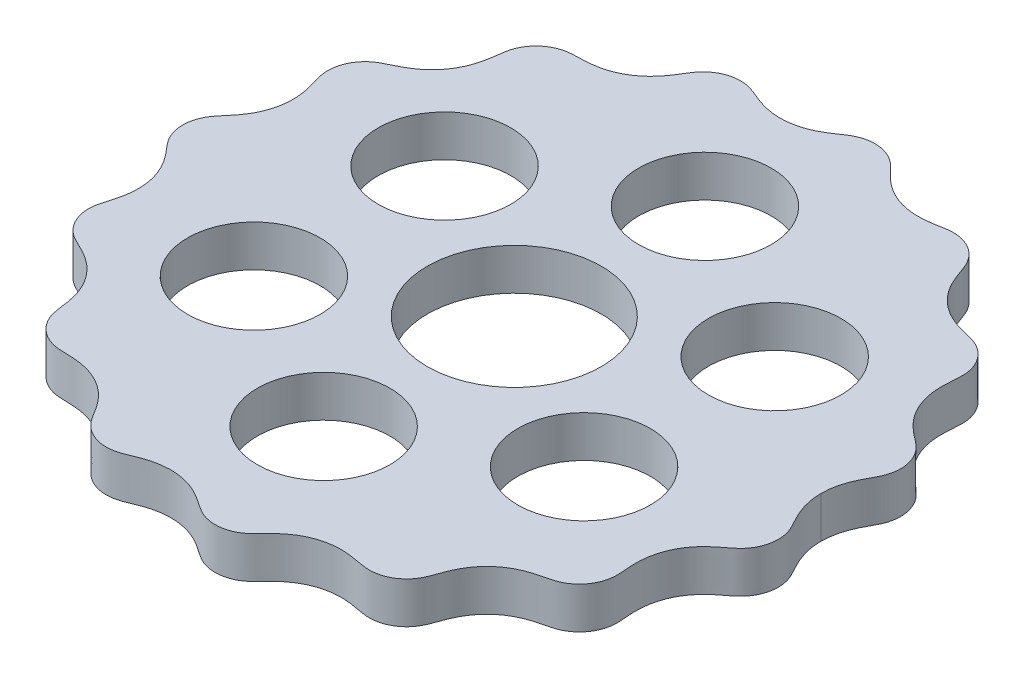
from build123d import *

# Parameters (mm, degrees)
SKETCH1_R           = 10.5
SKETCH1_R_2         = 8
BOSS_EXTRUDE1_DEPTH = 5


with BuildPart() as part:
    # Sketch1 → Boss-Extrude1 (new body)
    with BuildSketch(Plane(origin=(0, 0, 0), x_dir=(1, 0, 0), z_dir=(0, 1, 0))):
        with BuildLine():
            add(Edge.make_bspline(
                [(37, 0), (37, -0.03143727), (37.000453604, -0.094999987), (37.002494823, -0.209960319), (37.007935699, -0.365962041), (37.018130067, -0.547435978), (37.035778539, -0.762613663), (37.062295011, -1.000704503), (37.099596576, -1.254145629), (37.141666769, -1.490121949), (37.186730566, -1.707704996), (37.27599878, -2.086217996), (37.432607644, -2.61967024), (37.650272858, -3.191702622), (37.93344139, -3.795551093), (38.205952219, -4.315706499), (38.450459887, -4.760622269), (38.70692772, -5.235202277), (38.941768983, -5.756697541), (39.137855891, -6.378800099), (39.247955338, -7.103857197), (39.228570469, -7.939956238), (39.019285386, -8.855824089), (38.577559758, -9.823505319), (37.820964583, -10.754370621), (36.848063751, -11.434964366), (35.925475538, -12.170726431), (35.15516003, -12.931370117), (34.54379505, -13.69507461), (33.895237033, -14.741994379), (33.428420875, -15.89037885), (33.16127245, -17.104145416), (33.090755906, -18.276711654), (33.117928675, -19.134785899), (33.184630754, -19.922725011), (33.242632466, -20.644624385), (33.219628568, -21.437875666), (33.036316371, -22.28173929), (32.662226146, -23.128482681), (32.07870968, -23.926433825), (31.270520944, -24.647504284), (30.212930356, -25.19576041), (29.05618735, -25.42594367), (27.921165014, -25.714783041), (26.912865036, -26.088040866), (26.04670806, -26.526543792), (25.231490798, -27.070153578), (24.486296273, -27.716224909), (23.823206932, -28.456781999), (23.254813288, -29.28043732), (22.819009974, -30.105428972), (22.489240246, -30.904456359), (22.226168392, -31.656017359), (21.986325362, -32.344433223), (21.645702746, -33.067171886), (21.136896315, -33.772149992), (20.444596547, -34.405183962), (19.573466112, -34.908137767), (18.679093954, -35.191155104), (17.814153371, -35.279328837), (17.017950382, -35.212908103), (16.301803877, -35.076487107), (15.519474027, -34.928387551), (14.662477813, -34.814713427), (13.480415131, -34.769744423), (12.24114903, -34.919564924), (11.051981736, -35.275534421), (9.949378285, -35.820248955), (9.136432454, -36.351322247), (8.309098279, -37.037782147), (7.491403013, -37.876399022), (6.713712112, -38.763029071), (5.710099738, -39.404826424), (4.681547406, -39.744189192), (3.698738629, -39.8505626), (2.778395229, -39.751156366), (1.955929975, -39.487981912), (1.257453315, -39.111274685), (0.66127052, -38.700097997), (0.01224613, -38.248357139), (-0.717280827, -37.795796162), (-1.768012922, -37.270567489), (-2.95273679, -36.895066329), (-4.18067966, -36.725111536), (-5.411611299, -36.763370496), (-6.378691756, -36.910893684), (-7.422567545, -37.197831252), (-8.521082833, -37.628680278), (-9.596894828, -38.131330913), (-10.781414037, -38.320591212), (-11.865254321, -38.217684032), (-12.80999509, -37.9179101), (-13.765403055, -37.370059654), (-14.639711952, -36.510029041), (-15.224959633, -35.447056134), (-15.875186541, -34.432134448), (-16.722685045, -33.381987434), (-17.645169148, -32.549366783), (-18.695344863, -31.881164301), (-19.839308599, -31.403126169), (-20.793085274, -31.134677942), (-21.881721134, -30.964500418), (-23.08542905, -30.908652495), (-24.29883225, -30.933417714), (-25.48067958, -30.606197148), (-26.432898172, -30.052748184), (-27.164845045, -29.384446692), (-27.795906987, -28.497278621), (-28.22424747, -27.376816762), (-28.326856094, -26.193816744), (-28.502980453, -25.027046281), (-28.77642721, -23.979556748), (-29.132206305, -23.068277652), (-29.714540354, -21.983130932), (-30.475695851, -21.00467793), (-31.393252135, -20.166428113), (-32.373478982, -19.519081263), (-33.130172271, -19.113573458), (-33.84590289, -18.77737139), (-34.500084654, -18.46665169), (-35.175559663, -18.050104616), (-35.814710148, -17.469419425), (-36.360966849, -16.722076386), (-36.760254169, -15.817760445), (-36.980625548, -14.757313596), (-36.926633396, -13.567284637), (-36.547607451, -12.450425228), (-36.230236904, -11.323045641), (-36.049340213, -10.26320608), (-35.996011997, -9.293835891), (-36.059190915, -8.316040478), (-36.246094895, -7.347633333), (-36.555913141, -6.403126162), (-36.984986238, -5.499015409), (-37.4816085, -4.709168383), (-38.008605013, -4.023960491), (-38.528096971, -3.420524046), (-39.004092361, -2.868313104), (-39.352986229, -2.366627777), (-39.578197628, -1.930892753), (-39.717578718, -1.588781598), (-39.798314559, -1.352462416), (-39.865873622, -1.112280963), (-39.913167386, -0.89900512), (-39.945298995, -0.714032442), (-39.966442184, -0.560824818), (-39.979976403, -0.438104208), (-39.99012853, -0.31081675), (-39.99689741, -0.175935477), (-39.999435894, -0.08120679), (-40, -0.026915073), (-40, 0)],
                knots=[0.06614426, 0.06614426, 0.06614426, 0.06614426, 0.06614426, 0.067102742, 0.068061224, 0.069019706, 0.069978188, 0.071895152, 0.073812116, 0.075273751, 0.076735387, 0.078197023, 0.079658659, 0.085505202, 0.091351745, 0.094275016, 0.097198288, 0.100954467, 0.104710646, 0.108466825, 0.112223004, 0.118069589, 0.123916173, 0.130338535, 0.136760898, 0.145879075, 0.154997253, 0.161421442, 0.167845631, 0.17426982, 0.18069401, 0.193736695, 0.200258038, 0.206779381, 0.211541823, 0.216304265, 0.221066707, 0.225829148, 0.232348859, 0.238868571, 0.245245472, 0.251622373, 0.260676895, 0.269731417, 0.276109562, 0.282487707, 0.288865852, 0.295243997, 0.301811097, 0.308378198, 0.314945298, 0.321512399, 0.326307116, 0.331101834, 0.335896552, 0.340691269, 0.347256117, 0.353820965, 0.360385813, 0.366950661, 0.371745379, 0.376540096, 0.381334814, 0.386129532, 0.392696632, 0.399263733, 0.412397934, 0.418776079, 0.425154223, 0.431532368, 0.437910513, 0.446965035, 0.456019557, 0.462396459, 0.46877336, 0.475293071, 0.481812782, 0.486575224, 0.491337666, 0.496100107, 0.500862549, 0.507383892, 0.513905235, 0.526947921, 0.53337211, 0.539796299, 0.546220489, 0.552644678, 0.561762855, 0.570881032, 0.577303395, 0.583725757, 0.590229974, 0.596734191, 0.606102622, 0.615471053, 0.621977695, 0.628484337, 0.641497621, 0.648004263, 0.654510905, 0.661017547, 0.667524189, 0.67689262, 0.686261051, 0.692765268, 0.699269485, 0.705691847, 0.71211421, 0.721232387, 0.730350565, 0.736774754, 0.743198943, 0.749623132, 0.756047322, 0.769090007, 0.77561135, 0.782132693, 0.786895135, 0.791657577, 0.796420019, 0.80118246, 0.807702171, 0.814221883, 0.820598784, 0.826975685, 0.836030207, 0.845084729, 0.851462874, 0.857841019, 0.864219164, 0.870597309, 0.877164409, 0.88373151, 0.89029861, 0.896865711, 0.901660428, 0.906455146, 0.911249864, 0.916044581, 0.917685793, 0.919327005, 0.920968217, 0.922609429, 0.924250641, 0.925071247, 0.925891853, 0.926712459, 0.927533065, 0.928353671, 0.929174277, 0.929174277, 0.929174277, 0.929174277, 0.929174277], degree=4))
            add(Edge.make_bspline(
                [(-40, 0), (-40, 0.026915073), (-39.999435898, 0.081102132), (-39.996897439, 0.173969707), (-39.990128591, 0.308512197), (-39.979976315, 0.43784111), (-39.96644193, 0.561596862), (-39.949527385, 0.683811751), (-39.92923545, 0.806418669), (-39.905569953, 0.929082564), (-39.878536112, 1.05108509), (-39.840542165, 1.202393225), (-39.788245672, 1.382030281), (-39.717511124, 1.588706673), (-39.612678592, 1.8465975), (-39.4787487, 2.123083835), (-39.310663945, 2.414096923), (-39.104945299, 2.715281305), (-38.881313352, 3.003243592), (-38.647115103, 3.282501031), (-38.34984736, 3.627713203), (-37.95291863, 4.096180366), (-37.481683121, 4.709256859), (-36.984926096, 5.498908372), (-36.555971315, 6.403267497), (-36.170215472, 7.578337946), (-35.9868127, 8.798814705), (-36.009059108, 10.024440425), (-36.200622014, 11.152023378), (-36.408520549, 11.955019807), (-36.630718407, 12.680349542), (-36.821563566, 13.341696839), (-36.992348492, 14.33180594), (-36.904909082, 15.422182159), (-36.504382838, 16.524262833), (-35.814997617, 17.469697467), (-35.175412137, 18.050006312), (-34.5001255, 18.466591368), (-33.84600501, 18.777687977), (-32.905560624, 19.218134843), (-31.725163504, 19.887218348), (-30.439584969, 20.966645125), (-29.285197967, 22.586057403), (-28.686625036, 24.137217697), (-28.434119871, 25.439027518), (-28.31164158, 26.439459997), (-28.21864172, 27.126579635), (-28.036118522, 27.870890122), (-27.694662989, 28.638492196), (-27.164686183, 29.384972568), (-26.433444718, 30.052566346), (-25.634630631, 30.516068805), (-24.823088132, 30.788827784), (-24.04685872, 30.899230803), (-23.334712945, 30.920266621), (-22.306444557, 30.937751057), (-20.963494482, 31.058617768), (-19.344902311, 31.506985138), (-17.613398371, 32.506669405), (-16.415804752, 33.684227657), (-15.639656073, 34.786823183), (-15.110379913, 35.668587511), (-14.736089473, 36.274805934), (-14.252362947, 36.891838815), (-13.610375494, 37.458275746), (-12.809563546, 37.918317809), (-11.865789642, 38.217794604), (-10.954330273, 38.303527797), (-10.118839611, 38.215435923), (-9.382986221, 38.00135041), (-8.741423229, 37.738330824), (-7.813784142, 37.344183911), (-6.560131184, 36.91195486), (-4.917500499, 36.654754125), (-2.937854825, 36.844776382), (-1.360254549, 37.418406773), (-0.190612674, 38.106118753), (0.66104769, 38.700344294), (1.25752551, 39.11128049), (1.955942055, 39.487804143), (2.778297019, 39.751545742), (3.94176, 39.875855803), (5.096453052, 39.671677477), (6.084466159, 39.202219931), (6.856533473, 38.559253291), (7.333854157, 38.063319478), (7.850909823, 37.508190885), (8.442374814, 36.92670684), (9.323110596, 36.196912537), (10.58841665, 35.435636692), (11.999200644, 34.94870835), (13.48033229, 34.769799778), (14.662523081, 34.814686453), (15.519442707, 34.928402455), (16.301826743, 35.076481327), (17.01792965, 35.21290787), (17.814178726, 35.27933238), (18.679056308, 35.191146999), (19.573524947, 34.908152618), (20.444504658, 34.405159426), (21.137044029, 33.772190195), (21.591803381, 33.141505578), (21.869639533, 32.592625152), (22.075891139, 32.086193752), (22.226561366, 31.656080042), (22.376591176, 31.226097871), (22.593668003, 30.651444897), (22.86151291, 30.024879345), (23.255100485, 29.280174836), (23.822818619, 28.457094584), (24.649069231, 27.534594711), (25.802527601, 26.61516732), (27.218058872, 25.905303721), (28.817567995, 25.472660001), (30.452832349, 25.14875342), (31.698805724, 24.383263182), (32.56091801, 23.351770837), (33.037621539, 22.281751264), (33.218869869, 21.437861265), (33.242984107, 20.64464847), (33.184772246, 19.922675951), (33.096291135, 18.887971334), (33.085336205, 17.531197285), (33.377495648, 15.878125019), (34.202660288, 14.068701252), (35.246780487, 12.774733869), (36.247889348, 11.905159004), (37.053074749, 11.298868113), (37.601617193, 10.874775338), (38.154972669, 10.344538529), (38.64897071, 9.665047684), (39.030511654, 8.832802317), (39.242952499, 7.865782472), (39.245093638, 6.94215806), (39.075312522, 6.10308858), (38.783182879, 5.375443563), (38.444617083, 4.748588598), (38.126578469, 4.173031944), (37.854861766, 3.633998474), (37.633034591, 3.131674523), (37.47857496, 2.727184292), (37.362612428, 2.374730281), (37.2774171, 2.077549654), (37.216377239, 1.837879163), (37.162604445, 1.596443845), (37.116253691, 1.353582746), (37.077446812, 1.109379842), (37.050179424, 0.893728529), (37.031634183, 0.710857807), (37.019415923, 0.558351339), (37.011589025, 0.433066649), (37.00424606, 0.269586224), (37.00097986, 0.133534053), (37, 0.053352873), (37, 0)],
                knots=[0.070825729, 0.070825729, 0.070825729, 0.070825729, 0.070825729, 0.071646335, 0.072466941, 0.073287547, 0.074108153, 0.074928759, 0.075749365, 0.076569971, 0.077390577, 0.078211183, 0.079031789, 0.080673002, 0.082314214, 0.083955426, 0.086352785, 0.088750144, 0.091147503, 0.093544862, 0.095942221, 0.09833958, 0.103134298, 0.109701399, 0.1162685, 0.122835601, 0.129402703, 0.142158993, 0.148537139, 0.154915284, 0.159442546, 0.163969807, 0.168497068, 0.17302433, 0.185778133, 0.192297845, 0.198817557, 0.203579999, 0.208342441, 0.213104883, 0.217867326, 0.230910013, 0.243952699, 0.256801079, 0.269649459, 0.274208548, 0.278767637, 0.283326726, 0.287885815, 0.294308178, 0.300730541, 0.307234758, 0.313738976, 0.318423192, 0.323107408, 0.327791624, 0.33247584, 0.345489125, 0.35850241, 0.371515695, 0.38452898, 0.389213196, 0.393897412, 0.398581628, 0.403265844, 0.409770061, 0.416274278, 0.422696641, 0.429119005, 0.433678094, 0.438237183, 0.442796272, 0.447355361, 0.46020374, 0.47305212, 0.486094807, 0.499137494, 0.503899936, 0.508662378, 0.51342482, 0.518187263, 0.524706974, 0.531226686, 0.54398049, 0.548507751, 0.553035012, 0.557562274, 0.562089535, 0.568467681, 0.574845826, 0.587602117, 0.600736319, 0.60730342, 0.613870521, 0.618665239, 0.623459957, 0.628254676, 0.633049394, 0.639614242, 0.64617909, 0.652743939, 0.659308787, 0.664103505, 0.666500865, 0.668898224, 0.673692942, 0.676090301, 0.67848766, 0.685054761, 0.691621862, 0.698188963, 0.704756064, 0.717512355, 0.730268646, 0.739323169, 0.748377691, 0.761131495, 0.767651207, 0.774170918, 0.778933361, 0.783695803, 0.788458245, 0.793220687, 0.806263374, 0.819306061, 0.832154441, 0.84500282, 0.849561909, 0.854120998, 0.858680087, 0.863239176, 0.869661539, 0.876083903, 0.88258812, 0.889092337, 0.893776553, 0.898460769, 0.903144985, 0.907829201, 0.911082522, 0.914335844, 0.917589165, 0.919215826, 0.920842486, 0.922469147, 0.924095807, 0.925722468, 0.927349129, 0.928975789, 0.92978912, 0.93060245, 0.93141578, 0.932229111, 0.933855771, 0.933855771, 0.933855771, 0.933855771, 0.933855771], degree=4))
        make_face()
        Circle(SKETCH1_R, mode=Mode.SUBTRACT)
        with Locations((0, 23)):
            Circle(SKETCH1_R_2, mode=Mode.SUBTRACT)
        with Locations((19.918584287, 11.5)):
            Circle(SKETCH1_R_2, mode=Mode.SUBTRACT)
        with Locations((19.918584287, -11.5)):
            Circle(SKETCH1_R_2, mode=Mode.SUBTRACT)
        with Locations((0, -23)):
            Circle(SKETCH1_R_2, mode=Mode.SUBTRACT)
        with Locations((-19.918584287, -11.5)):
            Circle(SKETCH1_R_2, mode=Mode.SUBTRACT)
        with Locations((-19.918584287, 11.5)):
            Circle(SKETCH1_R_2, mode=Mode.SUBTRACT)
    extrude(amount=BOSS_EXTRUDE1_DEPTH)


solid = part.part
